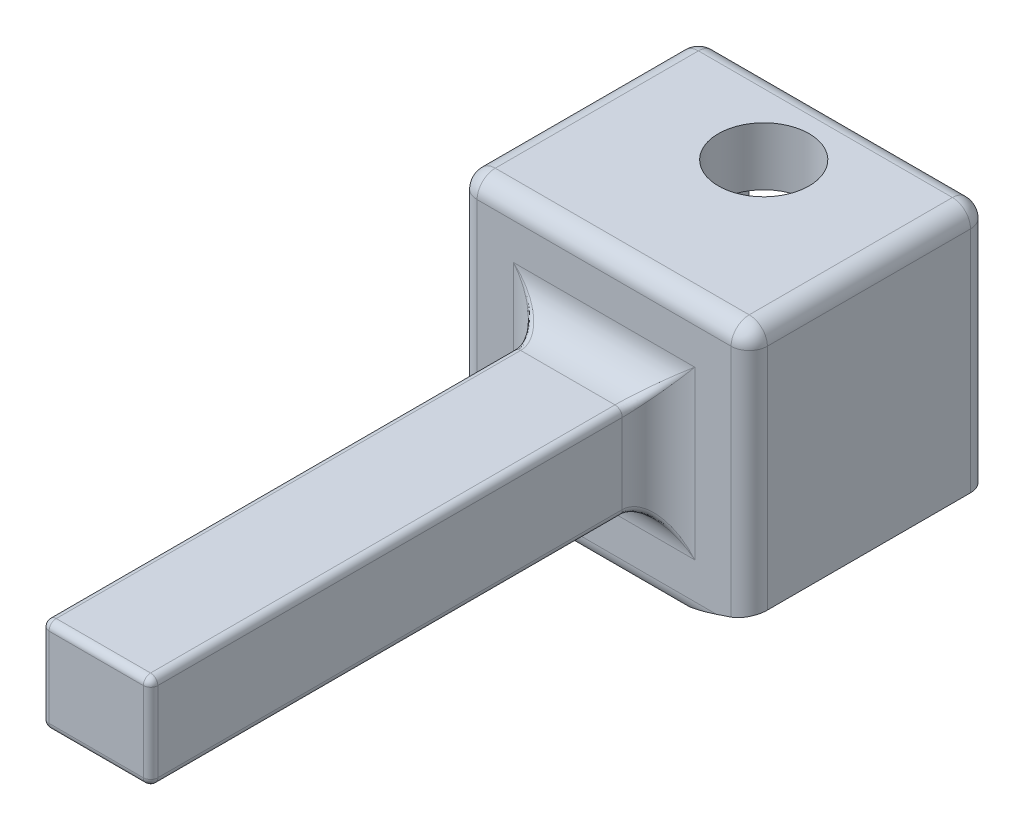
from build123d import *

# Parameters (mm, degrees)
SKETCH1_W               = 10.16
SKETCH1_H               = 9.652
BOSS_EXTRUDE1_DEPTH     = 7.112
CUT_EXTRUDE1_DEPTH      = 14.021061708
CUT_EXTRUDE1_DEPTH_BACK = 14.021061708
SKETCH2_R               = 1.5875
SKETCH7_W               = 10.16
SKETCH7_H               = 9.652
BOSS_EXTRUDE3_DEPTH     = 1.27
FILLET1_R               = 0.635
FILLET3_R               = 0.635
FILLET4_R               = 0.381
CUT_EXTRUDE3_DEPTH      = 14.485940976
CUT_EXTRUDE3_DEPTH_BACK = 14.485940976
FILLET9_R               = 0.254
CUT_EXTRUDE7_DEPTH      = 9.654656319
SKETCH14_W              = 3.81
SKETCH14_H              = 3.302
BOSS_EXTRUDE4_DEPTH     = 17.78
FILLET14_R              = 1.27
FILLET15_R              = 0.254


with BuildPart() as part:
    # Sketch1 → Boss-Extrude1 (new body)
    with BuildSketch(Plane.XY):
        Rectangle(SKETCH1_W, SKETCH1_H)
        Polygon((-4.318, -3.81), (4.318, -3.81), (4.318, -1.016), (3.302, -1.016), (3.302, 2.794), (-3.302, 2.794), (-3.302, -1.016), (-4.318, -1.016), align=None, mode=Mode.SUBTRACT)
    extrude(amount=BOSS_EXTRUDE1_DEPTH)

    # Sketch2 → Cut-Extrude1 (cut, two sides: drawn at the far end of the back side and taken through both)
    with BuildSketch(Plane(origin=(0, 4.826, 0), x_dir=(1, 0, 0), z_dir=(0, 1, 0)).offset(-CUT_EXTRUDE1_DEPTH_BACK)):
        with Locations(Location((0, -2.794, 0), (0, 0, 90))):
            Circle(SKETCH2_R)
    extrude(amount=CUT_EXTRUDE1_DEPTH + CUT_EXTRUDE1_DEPTH_BACK, mode=Mode.SUBTRACT)

    # Sketch7 → Boss-Extrude3 (add)
    with BuildSketch(Plane.XY.offset(7.112)):
        Rectangle(SKETCH7_W, SKETCH7_H)
    extrude(amount=BOSS_EXTRUDE3_DEPTH)

    # Fillet1
    fillet1_edges = [part.edges().sort_by_distance(p)[0] for p in [
        (-5.08, 0, 0),
        (0, 4.826, 0),
        (5.08, 0, 0),
    ]]
    fillet(fillet1_edges, radius=FILLET1_R)

    # Fillet3
    # the kernel refuses this fillet: 0.635 mm, written as the material it takes off along each edge
    with BuildSketch(Plane(origin=(4.445, 4.191, 0.635), x_dir=(1, 0, 0), z_dir=(0, 1, 0))) as fillet3_piece_1_section:
        Polygon((0, 0), (FILLET3_R, 0), (FILLET3_R, FILLET3_R), (0, FILLET3_R), align=None)
    fillet3_piece_1 = extrude(amount=FILLET3_R, mode=Mode.PRIVATE)
    fillet3_piece_1 = fillet3_piece_1 - Plane(origin=(4.445, 4.191, 0.635), x_dir=(-0.7071067811865475, 0, 0.7071067811865475), z_dir=(0, 1, 0)) * Sphere(FILLET3_R, mode=Mode.PRIVATE)
    add(fillet3_piece_1, mode=Mode.SUBTRACT)
    with BuildSketch(Plane(origin=(-4.445, 4.191, 0.635), x_dir=(-1, 0, 0), z_dir=(0, 1, 0))) as fillet3_piece_2_section:
        Polygon((0, 0), (FILLET3_R, 0), (FILLET3_R, -FILLET3_R), (0, -FILLET3_R), align=None)
    fillet3_piece_2 = extrude(amount=FILLET3_R, mode=Mode.PRIVATE)
    fillet3_piece_2 = fillet3_piece_2 - Plane(origin=(-4.445, 4.191, 0.635), x_dir=(0.7071067811865475, 0, 0.7071067811865475), z_dir=(0, 1, 0)) * Sphere(FILLET3_R, mode=Mode.PRIVATE)
    add(fillet3_piece_2, mode=Mode.SUBTRACT)
    with BuildSketch(Plane(origin=(-4.445, -4.191, 7.747), x_dir=(0, 0, 1), z_dir=(-1, 0, 0))) as fillet3_piece_3_section:
        Polygon((0, 0), (FILLET3_R, 0), (FILLET3_R, -FILLET3_R), (0, -FILLET3_R), align=None)
    fillet3_piece_3 = extrude(amount=FILLET3_R, mode=Mode.PRIVATE)
    fillet3_piece_3 = fillet3_piece_3 - Plane(origin=(-4.445, -4.191, 7.747), x_dir=(0, 0.7071067811865475, -0.7071067811865475), z_dir=(-1, 0, 0)) * Sphere(FILLET3_R, mode=Mode.PRIVATE)
    add(fillet3_piece_3, mode=Mode.SUBTRACT)
    with BuildSketch(Plane(origin=(-4.445, 4.191, 7.747), x_dir=(-1, 0, 0), z_dir=(0, 1, 0))) as fillet3_piece_4_section:
        Polygon((0, 0), (FILLET3_R, 0), (FILLET3_R, FILLET3_R), (0, FILLET3_R), align=None)
    fillet3_piece_4 = extrude(amount=FILLET3_R, mode=Mode.PRIVATE)
    fillet3_piece_4 = fillet3_piece_4 - Plane(origin=(-4.445, 4.191, 7.747), x_dir=(0.7071067811865475, 0, -0.7071067811865475), z_dir=(0, 1, 0)) * Sphere(FILLET3_R, mode=Mode.PRIVATE)
    add(fillet3_piece_4, mode=Mode.SUBTRACT)
    with BuildSketch(Plane(origin=(4.445, -4.191, 7.747), x_dir=(1, 0, 0), z_dir=(0, 0, 1))) as fillet3_piece_5_section:
        Polygon((0, 0), (FILLET3_R, 0), (FILLET3_R, -FILLET3_R), (0, -FILLET3_R), align=None)
    fillet3_piece_5 = extrude(amount=FILLET3_R, mode=Mode.PRIVATE)
    fillet3_piece_5 = fillet3_piece_5 - Plane(origin=(4.445, -4.191, 7.747), x_dir=(-0.7071067811865476, 0.7071067811865475, 0), z_dir=(0, 0, 1)) * Sphere(FILLET3_R, mode=Mode.PRIVATE)
    add(fillet3_piece_5, mode=Mode.SUBTRACT)
    with BuildSketch(Plane(origin=(4.445, 4.191, 7.747), x_dir=(0, 0, 1), z_dir=(0, 1, 0))) as fillet3_piece_6_section:
        Polygon((0, 0), (FILLET3_R, 0), (FILLET3_R, FILLET3_R), (0, FILLET3_R), align=None)
    fillet3_piece_6 = extrude(amount=FILLET3_R, mode=Mode.PRIVATE)
    fillet3_piece_6 = fillet3_piece_6 - Plane(origin=(4.445, 4.191, 7.747), x_dir=(-0.7071067811865475, 0, -0.7071067811865475), z_dir=(0, 1, 0)) * Sphere(FILLET3_R, mode=Mode.PRIVATE)
    add(fillet3_piece_6, mode=Mode.SUBTRACT)
    with BuildSketch(Plane(origin=(-5.08, -4.191, 8.382), x_dir=(0, 0, -1), z_dir=(0, 1, 0))) as fillet3_piece_7:
        with BuildLine():
            CenterArc((FILLET3_R, -FILLET3_R), FILLET3_R, 90, 90)
            Line((0, -FILLET3_R), (0, 0))
            Line((0, 0), (FILLET3_R, 0))
        make_face()
    extrude(amount=8.382, mode=Mode.SUBTRACT)
    with BuildSketch(Plane(origin=(4.445, -4.826, 8.382), x_dir=(0, 1, 0), z_dir=(-1, 0, 0)), Plane(origin=(4.445, -4.826, 0), x_dir=(0, 0, 1), z_dir=(-1, 0, 0))) as fillet3_piece_8:
        with BuildLine():
            CenterArc((FILLET3_R, FILLET3_R), FILLET3_R, 180, 90)
            Line((0, FILLET3_R), (0, 0))
            Line((0, 0), (FILLET3_R, 0))
        make_face()
    extrude(amount=8.89, mode=Mode.SUBTRACT)
    with BuildSketch(Plane(origin=(5.08, 4.191, 8.382), x_dir=(-1, 0, 0), z_dir=(0, -1, 0))) as fillet3_piece_9:
        with BuildLine():
            CenterArc((FILLET3_R, FILLET3_R), FILLET3_R, 180, 90)
            Line((0, FILLET3_R), (0, 0))
            Line((0, 0), (FILLET3_R, 0))
        make_face()
    extrude(amount=8.382, mode=Mode.SUBTRACT)
    with BuildSketch(Plane(origin=(-4.445, 4.826, 8.382), x_dir=(0, 0, -1), z_dir=(1, 0, 0))) as fillet3_piece_10:
        with BuildLine():
            CenterArc((FILLET3_R, -FILLET3_R), FILLET3_R, 90, 90)
            Line((0, -FILLET3_R), (0, 0))
            Line((0, 0), (FILLET3_R, 0))
        make_face()
    extrude(amount=8.89, mode=Mode.SUBTRACT)
    with BuildSketch(Plane(origin=(4.445, -4.826, 0.635), x_dir=(0, 0, -1), z_dir=(-1, 0, 0))) as fillet3_piece_11:
        with BuildLine():
            CenterArc((0.635 - FILLET3_R, -FILLET3_R), FILLET3_R, 0, 90)
            Line((0.635, -FILLET3_R), (0.635, 0))
            Line((0.635, 0), (0.635 - FILLET3_R, 0))
        make_face()
    revolve(axis=Axis((4.445, -4.826, 0.635), (0, -1, 0)), revolution_arc=90, mode=Mode.SUBTRACT)
    with BuildSketch(Plane(origin=(-4.445, -4.826, 0.635), x_dir=(0, 0, -1), z_dir=(1, 0, 0))) as fillet3_piece_12:
        with BuildLine():
            CenterArc((0.635 - FILLET3_R, FILLET3_R), FILLET3_R, 270, 90)
            Line((0.635, FILLET3_R), (0.635, 0))
            Line((0.635, 0), (0.635 - FILLET3_R, 0))
        make_face()
    revolve(axis=Axis((-4.445, -4.826, 0.635), (0, 1, 0)), revolution_arc=90, mode=Mode.SUBTRACT)
    with BuildSketch(Plane(origin=(5.08, -4.826, 7.747), x_dir=(0, 1, 0), z_dir=(0, 0, -1)), Plane(origin=(-5.08, -4.826, 0.635), x_dir=(0, 1, 0), z_dir=(0, 0, 1)), Plane(origin=(-5.08, 4.826, 0.635), x_dir=(1, 0, 0), z_dir=(0, 0, 1)), Plane(origin=(5.08, 4.826, 7.747), x_dir=(-1, 0, 0), z_dir=(0, 0, -1))) as fillet3_piece_13:
        with BuildLine():
            CenterArc((FILLET3_R, -FILLET3_R), FILLET3_R, 90, 90)
            Line((0, -FILLET3_R), (0, 0))
            Line((0, 0), (FILLET3_R, 0))
        make_face()
    extrude(amount=7.112, mode=Mode.SUBTRACT)

    # Fillet4
    fillet4_edges = [part.edges().sort_by_distance(p)[0] for p in [
        (3.302, -1.016, 3.556),
        (-3.302, -1.016, 3.556),
    ]]
    fillet(fillet4_edges, radius=FILLET4_R)

    # Sketch11 → Cut-Extrude3 (cut, two sides: drawn at the far end of the back side and taken through both)
    with BuildSketch(Plane.ZY.offset(-4.318).offset(-CUT_EXTRUDE3_DEPTH_BACK)):
        Polygon((0, -3.81), (5.08, -3.81), (5.08, -4.064), (10.16, -4.826), (0, -4.826), align=None)
    extrude(amount=CUT_EXTRUDE3_DEPTH + CUT_EXTRUDE3_DEPTH_BACK, mode=Mode.SUBTRACT)

    # Fillet9
    fillet9_edges = [part.edges().sort_by_distance(p)[0] for p in [
        (-4.318, -3.81, 6.096),
        (4.318, -3.81, 6.096),
        (0, -3.81, 7.112),
    ]]
    fillet(fillet9_edges, radius=FILLET9_R)

    # Sketch13 → Cut-Extrude7 (cut, through all)
    with BuildSketch(Plane(origin=(0, 0, 5.08), x_dir=(-1, 0, 0), z_dir=(0, 0, -1))):
        Polygon((-5.08, -3.81), (-5.08, -4.826), (-2.032, -4.826), align=None)
        Polygon((5.08, -3.81), (5.08, -4.826), (2.032, -4.826), align=None)
    extrude(amount=-CUT_EXTRUDE7_DEPTH, mode=Mode.SUBTRACT)

    # Sketch14 → Boss-Extrude4 (add)
    with BuildSketch(Plane.XY.offset(8.382)):
        Rectangle(SKETCH14_W, SKETCH14_H)
    extrude(amount=BOSS_EXTRUDE4_DEPTH)

    # Fillet14
    fillet14_edges = [part.edges().sort_by_distance(p)[0] for p in [
        (0, 1.651, 8.382),
        (-1.905, 0, 8.382),
        (0, -1.651, 8.382),
        (1.905, 0, 8.382),
    ]]
    fillet(fillet14_edges, radius=FILLET14_R)

    # Fillet15
    fillet15_edges = [part.edges().sort_by_distance(p)[0] for p in [
        (1.905, 1.651, 17.907),
        (-1.905, 1.651, 17.907),
        (-1.905, -1.651, 17.907),
        (1.905, -1.651, 17.907),
        (0, 1.651, 26.162),
        (-1.905, 0, 26.162),
        (0, -1.651, 26.162),
        (1.905, 0, 26.162),
        (2.354517888, 2.100517888, 8.682614059),
        (2.354517888, -2.100517888, 8.682614059),
        (-2.354517888, 2.100517888, 8.682614059),
        (-2.354517888, -2.100517888, 8.682614059),
    ]]
    fillet(fillet15_edges, radius=FILLET15_R)


solid = part.part
